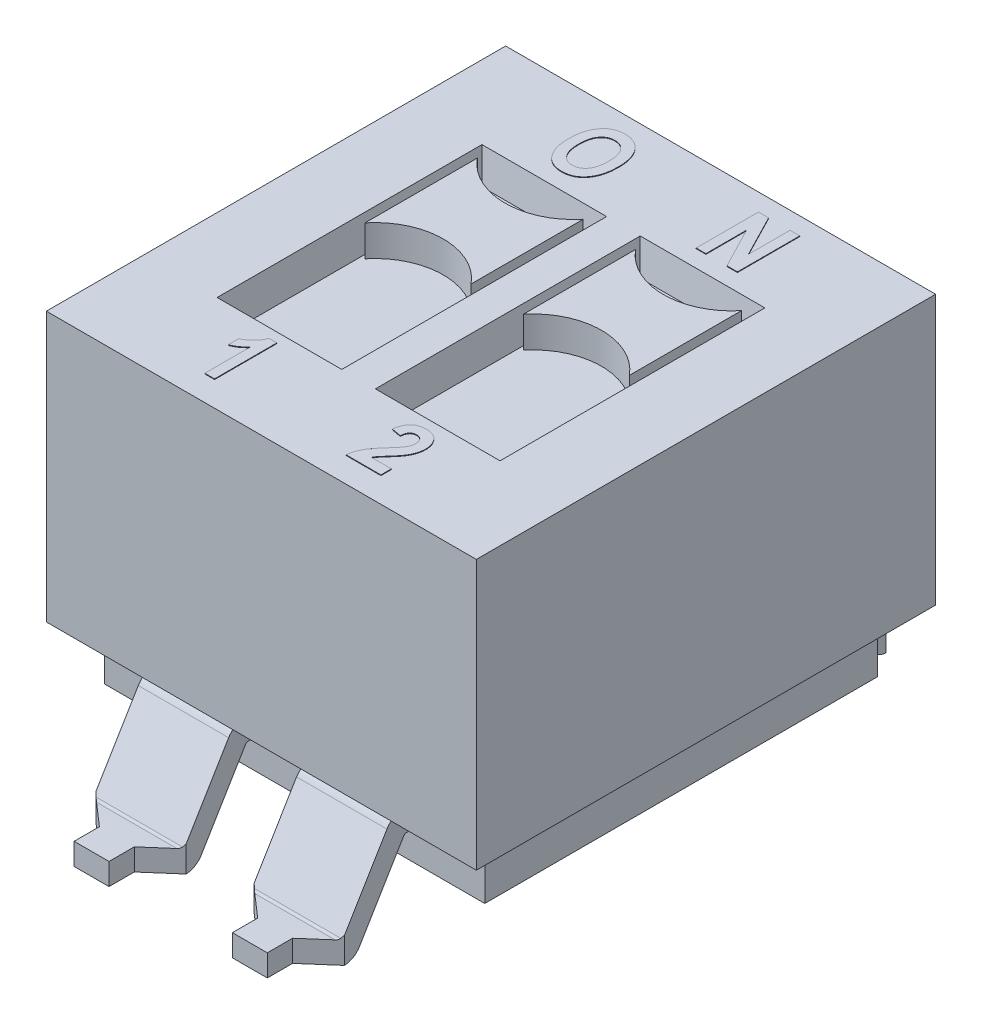
from build123d import *

# Parameters (mm, degrees)
SKETCH1_W              = 6.9
SKETCH1_H              = 7.37
BOSS_EXTRUDE1_DEPTH    = 4.32
BOSS_EXTRUDE2_DEPTH    = 1.7
SKETCH3_W              = 6.1
SKETCH3_H              = 6.3
BOSS_EXTRUDE3_DEPTH    = 0.93
CUT_EXTRUDE1_DEPTH     = 1.45
FILLET1_R              = 0.3
FILLET2_R              = 0.05
LPATTERN2_COUNT        = 2
LPATTERN2_PITCH        = 2.54
FILLET1_OF_LPATTERN2_R = 0.3
FILLET2_OF_LPATTERN2_R = 0.05
MIRROR2_START          = -1.55
MIRROR2_DEPTH          = 0.56
MIRROR2_START_2        = 0.99
MIRROR2_2_DEPTH        = 0.56
MIRROR2_3_DEPTH        = 1.7
MIRROR2_START_3        = -1.995
MIRROR2_4_DEPTH        = 3.99
SKETCH7_W              = 2
SKETCH7_H              = 4.25
CUT_EXTRUDE2_DEPTH     = 0.5
CUT_EXTRUDE2_DRAFT     = -10
BOSS_EXTRUDE4_DEPTH    = 0.5
BOSS_EXTRUDE5_DEPTH    = 0.01
LPATTERN3_START        = 0.27
LPATTERN3_DEPTH        = 2


with BuildPart() as part:
    # Sketch1 → Boss-Extrude1 (new body)
    with BuildSketch(Plane(origin=(0, 1.72, 0), x_dir=(-1, 0, 0), z_dir=(0, 1, 0))):
        Rectangle(SKETCH1_W, SKETCH1_H)
    extrude(amount=BOSS_EXTRUDE1_DEPTH)

    # Sketch3 → Boss-Extrude3 (add)
    with BuildSketch(Plane.XZ.offset(-1.72)):
        Rectangle(SKETCH3_W, SKETCH3_H)
    extrude(amount=BOSS_EXTRUDE3_DEPTH)


with BuildPart() as body_2:
    # Sketch2 → Boss-Extrude2 (new body)
    with BuildSketch(Plane(origin=(0, 0, 0), x_dir=(1, 0, 0), z_dir=(0, 1, 0))):
        Polygon((-0.99, -5.14), (-1.55, -5.14), (-1.55, -4.734143429), (-1.995, -4.34559509), (-1.995, -3.15), (-0.545, -3.15), (-0.545, -4.34559509), (-0.99, -4.734143429), align=None)
    boss_extrude2 = extrude(amount=BOSS_EXTRUDE2_DEPTH)

    # Sketch6 → Cut-Extrude1 (cut)
    with BuildSketch(Plane.ZY.offset(1.995)):
        Polygon((3.15, 1.35), (3.3795485, 1.35), (4.19, 0), (3.15, 0), align=None)
        Polygon((3.577658314, 1.7), (4.388109814, 0.35), (5.14, 0.35), (5.14, 1.7), align=None)
    cut_extrude1 = extrude(amount=-CUT_EXTRUDE1_DEPTH, mode=Mode.SUBTRACT)

    # Fillet1
    fillet1_edges = [body_2.edges().sort_by_distance(p)[0] for p in [
        (-1.27, 0, 4.19),
        (-1.27, 1.7, 3.577658314),
    ]]
    fillet(fillet1_edges, radius=FILLET1_R)

    # Fillet2
    fillet2_edges = [body_2.edges().sort_by_distance(p)[0] for p in [
        (-1.27, 1.35, 3.3795485),
        (-1.27, 0.35, 4.388109814),
    ]]
    fillet(fillet2_edges, radius=FILLET2_R)


with BuildPart() as part_1:
    add(part.part)

    # LPattern2: Boss-Extrude2, Cut-Extrude1 ×2
    with Locations(*[(i * LPATTERN2_PITCH, 0, 0) for i in range(1, LPATTERN2_COUNT)]):
        add(boss_extrude2)
        add(cut_extrude1, mode=Mode.SUBTRACT)

    # Fillet1 of LPattern2
    fillet1_of_lpattern2_edges = [part_1.edges().sort_by_distance(p)[0] for p in [
        (1.27, 0, 4.19),
        (1.27, 1.7, 3.577658314),
    ]]
    fillet(fillet1_of_lpattern2_edges, radius=FILLET1_OF_LPATTERN2_R)

    # Fillet2 of LPattern2
    fillet2_of_lpattern2_edges = [part_1.edges().sort_by_distance(p)[0] for p in [
        (1.27, 1.35, 3.3795485),
        (1.27, 0.35, 4.388109814),
    ]]
    fillet(fillet2_of_lpattern2_edges, radius=FILLET2_OF_LPATTERN2_R)

    # Mirror2: read off the stored shape, not the designer's step
    # Mirror2 outline → Mirror2 (add)
    with BuildSketch(Plane.YZ.offset(MIRROR2_START)):
        with BuildLine():
            ThreePointArc((1.554411974, -3.66505982), (1.661078142, -3.55562745), (1.7, -3.407849902))
            Line((1.7, -3.407849902), (1.7, -3.15))
            Line((1.7, -3.15), (1.35, -3.15))
            Line((1.35, -3.15), (1.35, -3.351247098))
            ThreePointArc((1.35, -3.351247098), (1.343513024, -3.375876689), (1.325735329, -3.394115417))
            Line((1.325735329, -3.394115417), (0.145588026, -4.102598493))
            ThreePointArc((0.145588026, -4.102598493), (0.038921858, -4.212030863), (0, -4.359808412))
            Line((0, -4.359808412), (0, -5.14))
            Line((0, -5.14), (0.35, -5.14))
            Line((0.35, -5.14), (0.35, -4.416411216))
            ThreePointArc((0.35, -4.416411216), (0.356486976, -4.391781624), (0.374264671, -4.373542896))
            Line((0.374264671, -4.373542896), (1.554411974, -3.66505982))
        make_face()
    extrude(amount=MIRROR2_DEPTH)

    # Mirror2 2 outline → Mirror2 2 (add)
    with BuildSketch(Plane.YZ.offset(MIRROR2_START_2)):
        with BuildLine():
            ThreePointArc((1.554411974, -3.66505982), (1.661078142, -3.55562745), (1.7, -3.407849902))
            Line((1.7, -3.407849902), (1.7, -3.15))
            Line((1.7, -3.15), (1.35, -3.15))
            Line((1.35, -3.15), (1.35, -3.351247098))
            ThreePointArc((1.35, -3.351247098), (1.343513024, -3.375876689), (1.325735329, -3.394115417))
            Line((1.325735329, -3.394115417), (0.145588026, -4.102598493))
            ThreePointArc((0.145588026, -4.102598493), (0.038921858, -4.212030863), (0, -4.359808412))
            Line((0, -4.359808412), (0, -5.14))
            Line((0, -5.14), (0.35, -5.14))
            Line((0.35, -5.14), (0.35, -4.416411216))
            ThreePointArc((0.35, -4.416411216), (0.356486976, -4.391781624), (0.374264671, -4.373542896))
            Line((0.374264671, -4.373542896), (1.554411974, -3.66505982))
        make_face()
    extrude(amount=MIRROR2_2_DEPTH)

    # Mirror2 3 outline → Mirror2 3 (add)
    with BuildSketch(Plane(origin=(0, 0, 0), x_dir=(1, 0, 0), z_dir=(0, 1, 0))):
        Polygon((1.55, 4.734143429), (1.55, 3.15), (1.995, 3.15), (1.995, 4.34559509), align=None)
        Polygon((-1.995, 3.15), (-1.55, 3.15), (-1.55, 4.734143429), (-1.995, 4.34559509), align=None)
        Polygon((-0.99, 3.15), (-0.545, 3.15), (-0.545, 4.34559509), (-0.99, 4.734143429), align=None)
        Polygon((0.545, 4.34559509), (0.545, 3.15), (0.99, 3.15), (0.99, 4.734143429), align=None)
    extrude(amount=MIRROR2_3_DEPTH)

    # Mirror2 4 outline → Mirror2 4 (cut)
    with BuildSketch(Plane.YZ.offset(MIRROR2_START_3)):
        with BuildLine():
            Line((1.35, -3.15), (0, -3.15))
            Line((0, -3.15), (0, -4.359808412))
            ThreePointArc((0, -4.359808412), (0.038921858, -4.212030863), (0.145588026, -4.102598493))
            Line((0.145588026, -4.102598493), (1.325735329, -3.394115417))
            ThreePointArc((1.325735329, -3.394115417), (1.343513024, -3.375876689), (1.35, -3.351247098))
            Line((1.35, -3.351247098), (1.35, -3.15))
        make_face()
        with BuildLine():
            ThreePointArc((1.7, -3.407849902), (1.661078142, -3.55562745), (1.554411974, -3.66505982))
            Line((1.554411974, -3.66505982), (0.374264671, -4.373542896))
            ThreePointArc((0.374264671, -4.373542896), (0.356486976, -4.391781624), (0.35, -4.416411216))
            Line((0.35, -4.416411216), (0.35, -4.734143429))
            Line((0.35, -4.734143429), (1.7, -4.734143429))
            Line((1.7, -4.734143429), (1.7, -3.407849902))
        make_face()
    extrude(amount=MIRROR2_4_DEPTH, mode=Mode.SUBTRACT)


with BuildPart() as cut_extrude2_tool:
    # Sketch7 → Cut-Extrude2 (with draft: the straight prism first)
    with BuildSketch(Plane(origin=(0, 6.04, 0), x_dir=(1, 0, 0), z_dir=(0, 1, 0))):
        with Locations((-1.27, 0)):
            Rectangle(SKETCH7_W, SKETCH7_H)
    extrude(amount=-CUT_EXTRUDE2_DEPTH)
    # Cut-Extrude2: the draft: its side faces are tilted about the plane it starts from
    cut_extrude2_sides = [cut_extrude2_tool.faces().sort_by_distance(p)[0] for p in [
        (-1.27, 5.79, -2.125),
        (-2.27, 5.79, 0),
        (-1.27, 5.79, 2.125),
        (-0.27, 5.79, 0),
    ]]
    draft(cut_extrude2_sides, Plane(origin=(0, 6.04, 0), x_dir=(1, 0, 0), z_dir=(0, 1, 0)), CUT_EXTRUDE2_DRAFT)


with BuildPart() as part_2:
    add(part_1.part)

    # Cut-Extrude2: cut by cut_extrude2_tool
    add(cut_extrude2_tool.part, mode=Mode.SUBTRACT)

    # Sketch8 → Boss-Extrude4 (add)
    with BuildSketch(Plane(origin=(0, 5.54, 0), x_dir=(1, 0, 0), z_dir=(0, 1, 0))):
        with BuildLine():
            Line((-2.12, 1.9), (-2.12, 0.1))
            ThreePointArc((-2.12, 0.1), (-1.27, 0.504010306), (-0.42, 0.1))
            Line((-0.42, 0.1), (-0.42, 1.9))
            ThreePointArc((-0.42, 1.9), (-1.27, 1.495989694), (-2.12, 1.9))
        make_face()
    extrude(amount=BOSS_EXTRUDE4_DEPTH)

    # Sketch9 → Boss-Extrude5 (add)
    # profile 1 of 4: a face of its own
    with BuildSketch(Plane(origin=(0, 6.04, 0), x_dir=(1, 0, 0), z_dir=(0, 1, 0))):
        with BuildLine():
            Line((-1.149938345, -3.286298172), (-1.305782501, -3.286298172))
            Line((-1.305782501, -3.286298172), (-1.305782501, -2.559025445))
            add(Edge.make_bspline(
                [(-1.305782501, -2.559025445), (-1.313340909, -2.566956808), (-1.328331003, -2.582686558), (-1.352179137, -2.604645876), (-1.376852064, -2.624891227), (-1.40251259, -2.643514397), (-1.428867099, -2.660692146), (-1.456248992, -2.676197328), (-1.484426084, -2.690062317), (-1.503851485, -2.697939652), (-1.513574708, -2.701882587)],
                knots=[0, 0, 0, 0, 1.033480345, 2.049633457, 3.05634389, 4.043072978, 5.039658923, 6.022790494, 7.010324124, 8, 8, 8, 8], degree=3))
            Line((-1.513574708, -2.701882587), (-1.513574708, -2.533051419))
            add(Edge.make_bspline(
                [(-1.513574708, -2.533051419), (-1.502367236, -2.52807032), (-1.47903391, -2.517699954), (-1.444898466, -2.496878418), (-1.410423043, -2.470803832), (-1.38181694, -2.445774281), (-1.359505231, -2.423505447), (-1.343607345, -2.405965993), (-1.329374638, -2.387440214), (-1.316184548, -2.368589399), (-1.304538562, -2.348874466), (-1.294256785, -2.328673892), (-1.285133287, -2.307855904), (-1.280374306, -2.293509485), (-1.277982176, -2.286298172)],
                knots=[0, 0, 0, 0, 1.256071058, 2.615068939, 4.086222451, 5.682781329, 6.506361962, 7.316438188, 8.106904776, 8.89922375, 9.673254088, 10.451495518, 11.221635059, 12, 12, 12, 12], degree=3))
            Line((-1.277982176, -2.286298172), (-1.149938345, -2.286298172))
            Line((-1.149938345, -2.286298172), (-1.149938345, -3.286298172))
        make_face()
    # profile 2 of 4: a face of its own
    with BuildSketch(Plane(origin=(0, 6.04, 0), x_dir=(1, 0, 0), z_dir=(0, 1, 0))):
        with BuildLine():
            Line((1.519931785, -3.117467003), (1.519931785, -3.286298172))
            Line((1.519931785, -3.286298172), (0.961490227, -3.286298172))
            add(Edge.make_bspline(
                [(0.961490227, -3.286298172), (0.963455078, -3.26967005), (0.967379443, -3.236458984), (0.979262606, -3.187715157), (0.99528093, -3.140096769), (1.012821056, -3.101322357), (1.030227436, -3.070014967), (1.045798623, -3.044470683), (1.064342218, -3.017288947), (1.085836063, -2.988506588), (1.109668848, -2.957697096), (1.136367675, -2.925183607), (1.165793497, -2.89093749), (1.186557975, -2.867701898), (1.197285681, -2.855697522)],
                knots=[0, 0, 0, 0, 1.20268352, 2.402099407, 3.598367202, 4.810420478, 5.454599206, 6.172593709, 6.960183653, 7.818888272, 8.754527026, 9.759992126, 10.842728215, 12, 12, 12, 12], degree=3))
            add(Edge.make_bspline(
                [(1.197285681, -2.855697522), (1.2056969, -2.846316403), (1.221788313, -2.828369485), (1.244422282, -2.802380663), (1.26478147, -2.779010382), (1.282217056, -2.757776186), (1.297343412, -2.739122067), (1.309879446, -2.722763662), (1.319975505, -2.708842778), (1.325371847, -2.700084276), (1.327764577, -2.696200769)],
                knots=[0, 0, 0, 0, 1.465870871, 2.804341841, 4.009590698, 5.071600616, 6.000740577, 6.80347298, 7.469461756, 8, 8, 8, 8], degree=3))
            add(Edge.make_bspline(
                [(1.327764577, -2.696200769), (1.333317743, -2.686252997), (1.344157646, -2.666834725), (1.355445691, -2.636063033), (1.362824019, -2.605235864), (1.363669537, -2.584498706), (1.364087629, -2.5742446)],
                knots=[0, 0, 0, 0, 1.060288104, 2.069705834, 3.04550853, 4, 4, 4, 4], degree=3))
            add(Edge.make_bspline(
                [(1.364087629, -2.5742446), (1.363728517, -2.563999182), (1.363048696, -2.544603948), (1.357230604, -2.51750551), (1.347504173, -2.494201226), (1.333445582, -2.475280095), (1.316330509, -2.460427733), (1.296589523, -2.449589604), (1.274247548, -2.443169232), (1.258542779, -2.442491509), (1.250451266, -2.442142328)],
                knots=[0, 0, 0, 0, 1.245810787, 2.358399634, 3.353971925, 4.295778042, 5.200327805, 6.09189762, 7.016895116, 8, 8, 8, 8], degree=3))
            add(Edge.make_bspline(
                [(1.250451266, -2.442142328), (1.241676873, -2.442525753), (1.224859212, -2.443260654), (1.201205822, -2.450102651), (1.180675896, -2.461381258), (1.163852243, -2.477750509), (1.150044642, -2.498201135), (1.140075836, -2.523339557), (1.133241009, -2.552688217), (1.131333401, -2.573799646), (1.130321395, -2.584999471)],
                knots=[0, 0, 0, 0, 0.999920937, 1.916523715, 2.784458762, 3.647604167, 4.570853193, 5.582015381, 6.717234977, 8, 8, 8, 8], degree=3))
            Line((1.130321395, -2.584999471), (0.97447724, -2.559025445))
            add(Edge.make_bspline(
                [(0.97447724, -2.559025445), (0.975782221, -2.54763324), (0.97831373, -2.525533713), (0.985017036, -2.493790813), (0.992955684, -2.464285551), (1.002895843, -2.437170623), (1.014683648, -2.412410662), (1.028359038, -2.39003296), (1.043527716, -2.369660972), (1.06095521, -2.351983012), (1.079946098, -2.336517116), (1.100372207, -2.322980337), (1.12238392, -2.311661035), (1.145789244, -2.302222001), (1.170800013, -2.295233779), (1.197161788, -2.289883975), (1.225083353, -2.286866536), (1.244153737, -2.286490414), (1.253900941, -2.286298172)],
                knots=[0, 0, 0, 0, 1.257113927, 2.438652199, 3.554660598, 4.606291011, 5.601856267, 6.557471959, 7.478981492, 8.381416587, 9.2725261, 10.161501808, 11.064119884, 11.98308707, 12.924775989, 13.908409216, 14.930951759, 16, 16, 16, 16], degree=3))
            add(Edge.make_bspline(
                [(1.253900941, -2.286298172), (1.264605321, -2.286470559), (1.285353353, -2.286804693), (1.315409287, -2.291140762), (1.343550291, -2.297318746), (1.369499473, -2.306928425), (1.393710512, -2.318487932), (1.415481991, -2.333452505), (1.435706939, -2.350413064), (1.453047129, -2.370548444), (1.468831822, -2.391831634), (1.482384778, -2.41426292), (1.494119449, -2.437246842), (1.50347034, -2.461194417), (1.510750187, -2.485919661), (1.515996505, -2.511369911), (1.519432921, -2.537557077), (1.519763773, -2.555294197), (1.519931785, -2.564301419)],
                knots=[0, 0, 0, 0, 1.185802577, 2.298411505, 3.360827086, 4.373838454, 5.359924385, 6.327149754, 7.295159843, 8.277960573, 9.264958702, 10.230903902, 11.180079425, 12.122922977, 13.076886226, 14.034409875, 15.001838751, 16, 16, 16, 16], degree=3))
            add(Edge.make_bspline(
                [(1.519931785, -2.564301419), (1.51976127, -2.574524987), (1.519422747, -2.594821872), (1.515946108, -2.625046473), (1.510811259, -2.654849877), (1.503194198, -2.684272166), (1.493344527, -2.71346301), (1.481350566, -2.742675129), (1.467138818, -2.772004403), (1.453144217, -2.796305447), (1.440604794, -2.816494375), (1.429438823, -2.832631542), (1.416713531, -2.849712407), (1.402785688, -2.868024374), (1.387109179, -2.887214955), (1.370066294, -2.907512527), (1.351597441, -2.92882171), (1.338675811, -2.943243273), (1.332025941, -2.950665055)],
                knots=[0, 0, 0, 0, 1.112568374, 2.208785751, 3.308090549, 4.402946702, 5.513734595, 6.659701235, 7.83876403, 9.059051271, 9.71083511, 10.425746939, 11.194567613, 12.029688168, 12.930202216, 13.891926091, 14.915120021, 16, 16, 16, 16], degree=3))
            add(Edge.make_bspline(
                [(1.332025941, -2.950665055), (1.325868354, -2.957494577), (1.314128813, -2.970515176), (1.297384241, -2.989160539), (1.282725239, -3.006265259), (1.269439319, -3.021206836), (1.258107075, -3.034423902), (1.248439604, -3.045752216), (1.240867224, -3.055525308), (1.229397755, -3.069803839), (1.215623384, -3.089902336), (1.205846161, -3.108511816), (1.201141201, -3.117467003)],
                knots=[0, 0, 0, 0, 1.297038255, 2.472825099, 3.534584971, 4.474279189, 5.292832013, 5.990344774, 6.574432518, 7.036342243, 8.573839243, 10, 10, 10, 10], degree=3))
            Line((1.201141201, -3.117467003), (1.519931785, -3.117467003))
        make_face()
    # profile 3 of 4: a face of its own
    with BuildSketch(Plane(origin=(0, 6.04, 0), x_dir=(1, 0, 0), z_dir=(0, 1, 0))):
        with BuildLine():
            add(Edge.make_bspline(
                [(-1.647773304, 2.890108565), (-1.647626855, 2.904587568), (-1.647340584, 2.932890429), (-1.644834935, 2.974320921), (-1.640922179, 3.013826649), (-1.634912883, 3.051303908), (-1.627830272, 3.086949777), (-1.618506591, 3.120472286), (-1.60819207, 3.152261227), (-1.59561281, 3.181870318), (-1.582094263, 3.209768794), (-1.56726016, 3.235652464), (-1.551588401, 3.259860289), (-1.534744689, 3.282090878), (-1.517076297, 3.302711079), (-1.498436619, 3.321467792), (-1.478560828, 3.338138083), (-1.457851471, 3.353300108), (-1.435882042, 3.366476007), (-1.412832922, 3.377832172), (-1.388806609, 3.387676242), (-1.363549788, 3.395588858), (-1.337131051, 3.401584106), (-1.309629484, 3.406100371), (-1.28101136, 3.40877239), (-1.261550564, 3.409044883), (-1.251669408, 3.40918324)],
                knots=[0, 0, 0, 0, 1.413007263, 2.762078904, 4.049593578, 5.285819603, 6.465306206, 7.594367978, 8.679938674, 9.724528792, 10.731323562, 11.704103677, 12.63428548, 13.544001443, 14.424033479, 15.282963126, 16.12148102, 16.953398054, 17.7855508, 18.618122424, 19.459105522, 20.317248336, 21.19802291, 22.101006911, 23.035792388, 24, 24, 24, 24], degree=3))
            add(Edge.make_bspline(
                [(-1.251669408, 3.40918324), (-1.23737188, 3.408830045), (-1.20930885, 3.408136797), (-1.168297634, 3.401596296), (-1.129246481, 3.39134795), (-1.092245651, 3.376628501), (-1.057363379, 3.357596859), (-1.024508841, 3.334494757), (-0.993670061, 3.307290384), (-0.965131661, 3.275984672), (-0.939080804, 3.240995232), (-0.916752072, 3.202002295), (-0.897583759, 3.159713721), (-0.882310722, 3.113679718), (-0.870049968, 3.064311428), (-0.861826783, 3.011336539), (-0.856299538, 2.954958191), (-0.855814946, 2.916164519), (-0.855565512, 2.896196227)],
                knots=[0, 0, 0, 0, 0.939885583, 1.844797075, 2.724414307, 3.591141889, 4.457241096, 5.332435845, 6.227757785, 7.156796134, 8.114335849, 9.091188046, 10.106791572, 11.163484353, 12.277169456, 13.449020478, 14.686932687, 16, 16, 16, 16], degree=3))
            add(Edge.make_bspline(
                [(-0.855565512, 2.896196227), (-0.855897863, 2.876026293), (-0.856546015, 2.836690826), (-0.862105706, 2.779387569), (-0.871114209, 2.725437496), (-0.883850571, 2.674907873), (-0.90029701, 2.62774112), (-0.920427809, 2.583967767), (-0.944027383, 2.543349399), (-0.963033036, 2.519036526), (-0.972448629, 2.506991682)],
                knots=[0, 0, 0, 0, 1.16723241, 2.276340154, 3.328694564, 4.330478862, 5.288855569, 6.215552891, 7.11596681, 8, 8, 8, 8], degree=3))
            add(Edge.make_bspline(
                [(-0.972448629, 2.506991682), (-0.981157381, 2.497103379), (-0.998336148, 2.477597844), (-1.027710246, 2.452325298), (-1.059247121, 2.430827292), (-1.093290103, 2.413560963), (-1.129449914, 2.399821448), (-1.167980904, 2.390117157), (-1.208817664, 2.384417321), (-1.236770239, 2.383617905), (-1.251060642, 2.383209214)],
                knots=[0, 0, 0, 0, 1.001181491, 1.974917111, 2.938062765, 3.897505349, 4.871145834, 5.87433439, 6.913280131, 8, 8, 8, 8], degree=3))
            add(Edge.make_bspline(
                [(-1.251060642, 2.383209214), (-1.26549156, 2.383500372), (-1.293669128, 2.384068881), (-1.334701187, 2.390245501), (-1.373462647, 2.399604814), (-1.409839022, 2.413071727), (-1.443839493, 2.430440213), (-1.475367604, 2.451774686), (-1.505055917, 2.47649798), (-1.522201929, 2.495928355), (-1.530890187, 2.50577415)],
                knots=[0, 0, 0, 0, 1.094964679, 2.13800963, 3.143281602, 4.118328618, 5.076193384, 6.03488399, 7.004232895, 8, 8, 8, 8], degree=3))
            add(Edge.make_bspline(
                [(-1.530890187, 2.50577415), (-1.540290828, 2.517828218), (-1.559194709, 2.542067915), (-1.582923221, 2.582323482), (-1.60304379, 2.625705693), (-1.619420507, 2.672349376), (-1.632239436, 2.722179739), (-1.64121606, 2.775259942), (-1.646797645, 2.831614996), (-1.647442508, 2.870276372), (-1.647773304, 2.890108565)],
                knots=[0, 0, 0, 0, 0.894191496, 1.798142236, 2.728299874, 3.690218715, 4.688169272, 5.737002699, 6.839146352, 8, 8, 8, 8], degree=3))
        make_face()
        with BuildLine():
            add(Edge.make_bspline(
                [(-1.491929148, 2.896804994), (-1.491764332, 2.88286413), (-1.491445415, 2.855888641), (-1.488149885, 2.816778446), (-1.482779889, 2.780348572), (-1.475068028, 2.746570975), (-1.465398241, 2.715454743), (-1.453694607, 2.686919244), (-1.439402356, 2.661262544), (-1.423132765, 2.638258401), (-1.405301637, 2.61799376), (-1.386316021, 2.60039638), (-1.366306132, 2.5853966), (-1.345190017, 2.573199189), (-1.322977606, 2.563712649), (-1.299794929, 2.55709246), (-1.275565219, 2.552849903), (-1.259060114, 2.552313533), (-1.250654797, 2.552040383)],
                knots=[0, 0, 0, 0, 1.417627784, 2.743101411, 3.988491279, 5.160055516, 6.263228156, 7.299411243, 8.291037632, 9.243541693, 10.159958133, 11.031397084, 11.872096295, 12.698114263, 13.505705719, 14.322185685, 15.145563694, 16, 16, 16, 16], degree=3))
            add(Edge.make_bspline(
                [(-1.250654797, 2.552040383), (-1.242186091, 2.552338409), (-1.22556583, 2.552923298), (-1.201151001, 2.556797385), (-1.177924287, 2.563522331), (-1.155817506, 2.572984594), (-1.134728114, 2.584954793), (-1.11507229, 2.600022328), (-1.096195194, 2.617307309), (-1.078755006, 2.637556689), (-1.062684969, 2.660403152), (-1.048782813, 2.686277175), (-1.037336389, 2.715064653), (-1.027845755, 2.746646418), (-1.020334438, 2.781035023), (-1.015240065, 2.818286452), (-1.01187971, 2.858323305), (-1.011569739, 2.88597511), (-1.011409668, 2.900254669)],
                knots=[0, 0, 0, 0, 0.856067668, 1.680075595, 2.491590685, 3.294271314, 4.105930429, 4.936043877, 5.792521075, 6.689215603, 7.631993153, 8.611021133, 9.650955643, 10.758472718, 11.941436728, 13.205325589, 14.55681326, 16, 16, 16, 16], degree=3))
            add(Edge.make_bspline(
                [(-1.011409668, 2.900254669), (-1.011601102, 2.914260777), (-1.011972432, 2.941428723), (-1.014913728, 2.980758337), (-1.02027933, 3.017188835), (-1.027149674, 3.050853211), (-1.036589611, 3.081636821), (-1.047739358, 3.109789142), (-1.061475273, 3.134875397), (-1.076942494, 3.157239483), (-1.094259644, 3.176700637), (-1.112841854, 3.193689624), (-1.132586709, 3.208203136), (-1.153630028, 3.22017936), (-1.176172158, 3.229036911), (-1.199843603, 3.235511876), (-1.224796237, 3.239808158), (-1.241910896, 3.240168151), (-1.250654797, 3.240352072)],
                knots=[0, 0, 0, 0, 1.432762357, 2.779159561, 4.030754787, 5.197882272, 6.290139775, 7.320663351, 8.289843535, 9.209309419, 10.096549751, 10.948805523, 11.780590523, 12.598531546, 13.418314419, 14.250962417, 15.106414475, 16, 16, 16, 16], degree=3))
            add(Edge.make_bspline(
                [(-1.250654797, 3.240352072), (-1.259399945, 3.240171813), (-1.276517044, 3.239818988), (-1.30151658, 3.235459925), (-1.325337823, 3.229141644), (-1.347875945, 3.219873832), (-1.369127406, 3.208021246), (-1.389129434, 3.193487439), (-1.407871597, 3.176297369), (-1.425338795, 3.156560265), (-1.441388332, 3.134160959), (-1.45485498, 3.108536451), (-1.466432174, 3.08027806), (-1.475752126, 3.049066116), (-1.482921408, 3.015049434), (-1.488123027, 2.978170276), (-1.491458896, 2.938465393), (-1.491768731, 2.911016634), (-1.491929148, 2.896804994)],
                knots=[0, 0, 0, 0, 0.8855316, 1.733273432, 2.565029, 3.379994694, 4.196545506, 5.026376759, 5.880638503, 6.769561942, 7.694238421, 8.666748973, 9.69692367, 10.785897995, 11.964055288, 13.217943305, 14.559585586, 16, 16, 16, 16], degree=3))
        make_face(mode=Mode.SUBTRACT)
    # profile 4 of 4: a face of its own
    with BuildSketch(Plane(origin=(0, 6.04, 0), x_dir=(1, 0, 0), z_dir=(0, 1, 0))):
        Polygon((0.89638254, 2.396196227), (0.89638254, 3.396196227), (1.059126047, 3.396196227), (1.402876047, 2.728379669), (1.402876047, 3.396196227), (1.558720203, 3.396196227), (1.558720203, 2.396196227), (1.390294878, 2.396196227), (1.052226696, 3.048387786), (1.052226696, 2.396196227), align=None)
    extrude(amount=BOSS_EXTRUDE5_DEPTH)

    # LPattern3: read off the stored shape, not the designer's step
    # LPattern3 outline → LPattern3 (cut)
    with BuildSketch(Plane.YZ.offset(LPATTERN3_START)):
        Polygon((5.54, 2.03683651), (5.54, -2.03683651), (6.04, -2.125), (6.04, 2.125), align=None)
    extrude(amount=LPATTERN3_DEPTH, mode=Mode.SUBTRACT)

    # LPattern3 2: loft between two sections, ruled curve by curve
    lpattern3_2_from = [
        Edge.make_three_point_arc((2.12, 6.04, -1.9), (1.27, 6.04, -1.495989694), (0.42, 6.04, -1.9)),
        Edge.make_three_point_arc((0.42, 6.04, -0.1), (1.27, 6.04, -0.504010306), (2.12, 6.04, -0.1)),
        Edge.make_line((0.42, 6.04, -1.9), (0.42, 6.04, -0.1)),
        Edge.make_line((2.12, 6.04, -0.1), (2.12, 6.04, -1.9)),
    ]
    lpattern3_2_to = [
        Edge.make_three_point_arc((2.12, 5.54, -1.9), (1.27, 5.54, -1.495989694), (0.42, 5.54, -1.9)),
        Edge.make_three_point_arc((0.42, 5.54, -0.1), (1.27, 5.54, -0.504010306), (2.12, 5.54, -0.1)),
        Edge.make_line((0.42, 5.54, -1.9), (0.42, 5.54, -0.1)),
        Edge.make_line((2.12, 5.54, -0.1), (2.12, 5.54, -1.9)),
    ]
    lpattern3_2 = Solid(Shell([*[Face.make_surface_from_curves(lpattern3_2_from[k], lpattern3_2_to[k]) for k in range(4)], Face(Wire(lpattern3_2_from)), Face(Wire(lpattern3_2_to))]))
    add(lpattern3_2)

    # LPattern3 3: loft between two sections, ruled curve by curve
    lpattern3_3_from = [
        Edge.make_line((0.35816349, 5.54, 2.03683651), (0.35816349, 5.54, -2.03683651)),
        Edge.make_line((0.35816349, 5.54, -2.03683651), (0.35816349, 5.54, 2.03683651)),
    ]
    lpattern3_3_to = [
        Edge.make_line((0.27, 6.04, 2.125), (0.27, 6.04, -2.125)),
        Edge.make_line((0.27, 6.04, -2.125), (0.27, 6.04, 2.125)),
    ]
    lpattern3_3 = Solid(Shell([*[Face.make_surface_from_curves(lpattern3_3_from[k], lpattern3_3_to[k]) for k in range(2)], Face(Wire(lpattern3_3_from)), Face(Wire(lpattern3_3_to))]))
    add(lpattern3_3)

    # LPattern3 4: loft between two sections, ruled curve by curve
    lpattern3_4_from = [
        Edge.make_line((2.18183651, 5.54, -2.03683651), (2.18183651, 5.54, 2.03683651)),
        Edge.make_line((2.18183651, 5.54, 2.03683651), (2.18183651, 5.54, -2.03683651)),
    ]
    lpattern3_4_to = [
        Edge.make_line((2.27, 6.04, -2.125), (2.27, 6.04, 2.125)),
        Edge.make_line((2.27, 6.04, 2.125), (2.27, 6.04, -2.125)),
    ]
    lpattern3_4 = Solid(Shell([*[Face.make_surface_from_curves(lpattern3_4_from[k], lpattern3_4_to[k]) for k in range(2)], Face(Wire(lpattern3_4_from)), Face(Wire(lpattern3_4_to))]))
    add(lpattern3_4)


solid = Compound([body_2.part, part_2.part])
